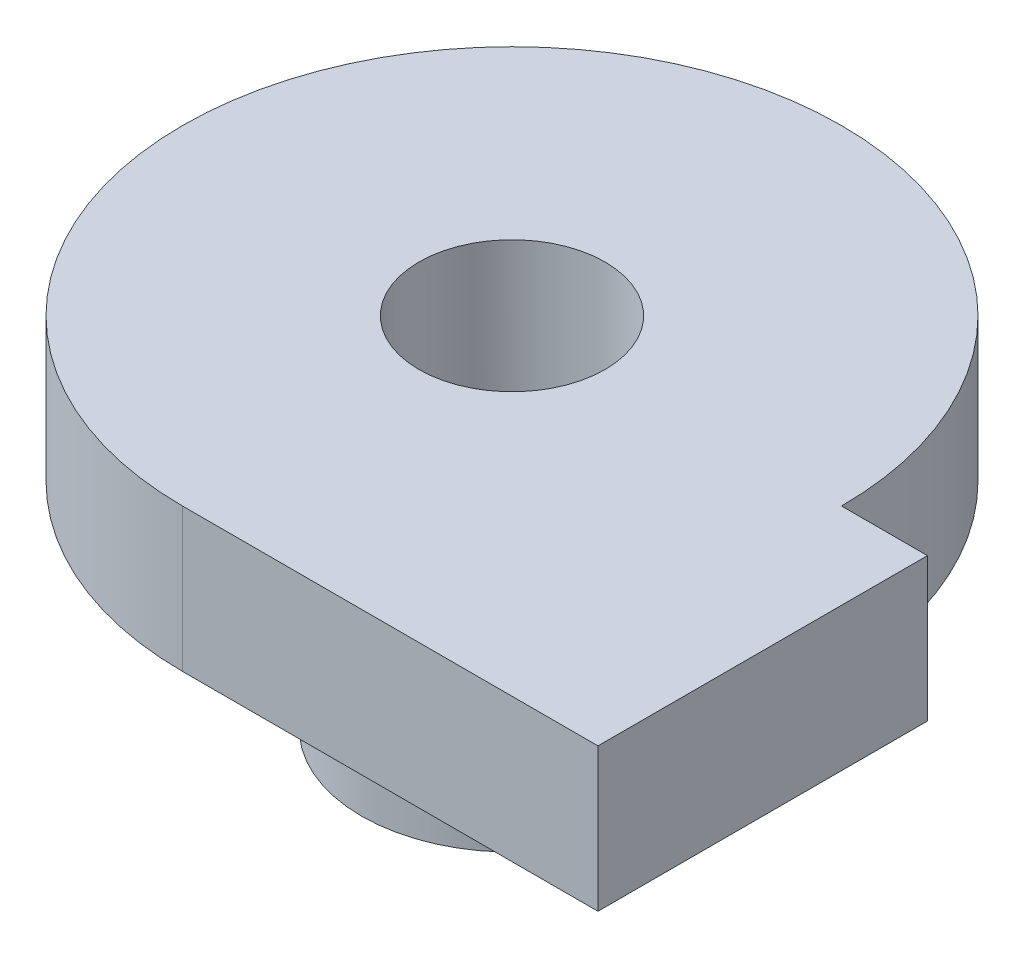
from build123d import *

# Parameters (mm, degrees)
SKETCH1_R           = 11.5
SKETCH1_R_2         = 3.25
BOSS_EXTRUDE1_DEPTH = 5
BOSS_EXTRUDE3_DEPTH = 5
BOSS_EXTRUDE4_START = 7.5
SKETCH6_R           = 5.25
SKETCH6_R_2         = 3.25
BOSS_EXTRUDE4_DEPTH = 7.5


with BuildPart() as part:
    # Sketch1 → Boss-Extrude1 (new body)
    with BuildSketch(Plane(origin=(0, 0, 0), x_dir=(1, 0, 0), z_dir=(0, 1, 0))):
        Circle(SKETCH1_R)
        Circle(SKETCH1_R_2, mode=Mode.SUBTRACT)
    extrude(amount=BOSS_EXTRUDE1_DEPTH)

    # Sketch5 → Boss-Extrude3 (add)
    with BuildSketch(Plane(origin=(0, 5, 0), x_dir=(1, 0, 0), z_dir=(0, 1, 0))):
        Polygon((0, -11.5), (14.5, -11.5), (14.5, 0), (10.856542912, 0), align=None)
    extrude(amount=-BOSS_EXTRUDE3_DEPTH)

    # Sketch6 → Boss-Extrude4 (add)
    with BuildSketch(Plane.XZ.offset(BOSS_EXTRUDE4_START)):
        Circle(SKETCH6_R)
        Circle(SKETCH6_R_2, mode=Mode.SUBTRACT)
    extrude(amount=-BOSS_EXTRUDE4_DEPTH)


solid = part.part
